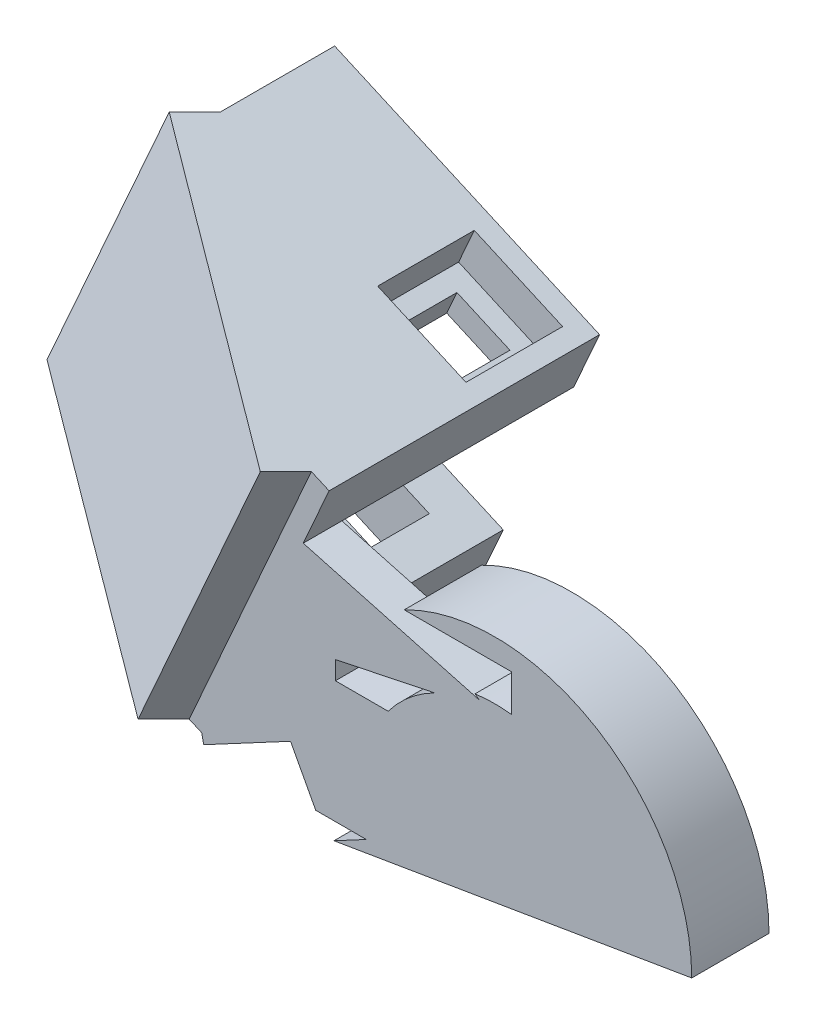
from build123d import *
from build123d.topology import SkipClean

# Parameters (mm, degrees)
BOSS_EXTRUDE1_DEPTH      = 5.08
CUT_EXTRUDE1_DEPTH       = 2.54
SKETCH3_W                = 9.11222741
SKETCH3_H                = 2.54
BOSS_EXTRUDE2_DEPTH      = 5.08
BOSS_EXTRUDE3_DEPTH      = 17.78
CUT_EXTRUDE2_DEPTH       = 15.24
CUT_EXTRUDE3_DEPTH       = 11.43
CHAMFER1_SIZE            = 10.265287786
CHAMFER1_SIZE_2          = 17.78
SKETCH7_W                = 3.81
SKETCH7_H                = 3.81
CUT_EXTRUDE4_DEPTH       = 25.4
SKETCH8_W                = 6.35
SKETCH8_H                = 6.35
CUT_EXTRUDE5_DEPTH       = 2.54
BOSS_EXTRUDE4_DEPTH      = 2.54
BOSS_EXTRUDE4_DEPTH_BACK = 2.54
BOSS_EXTRUDE5_START      = -5.08
BOSS_EXTRUDE5_DEPTH      = 5.08
BOSS_EXTRUDE6_START      = -2.54
BOSS_EXTRUDE6_DEPTH      = 2.54
CUT_EXTRUDE6_DEPTH       = 55.88
CUT_EXTRUDE7_START       = -5.08
CUT_EXTRUDE7_DEPTH       = 5.08
BOSS_EXTRUDE7_DEPTH      = 2.54


# Read off the part's stored shape, not the designer's step: Boss-Extrude5, Cut-Extrude7
with BuildPart() as part:
    # Sketch1 → Boss-Extrude1 (new body)
    with BuildSketch(Plane.XY):
        with BuildLine():
            Line((8.309836615, 7.848026213), (-11.143288506, -2.544016758))
            ThreePointArc((-11.143288506, -2.544016758), (-5.385698811, 10.08162429), (8.309836615, 7.848026213))
        make_face()
    extrude(amount=BOSS_EXTRUDE1_DEPTH)

    # Sketch2 → Cut-Extrude1 (cut)
    with SkipClean():  # the faces are left unmerged after this step: merging them gives an invalid solid
        with BuildSketch(Plane(origin=(0, 0, 0), x_dir=(-1, 0, 0), z_dir=(0, 0, -1))):
            with BuildLine():
                ThreePointArc((-3.514271346, 8.165904537), (4.188876853, 7.841263336), (8.741367154, 1.618826824))
                Line((8.741367154, 1.618826824), (-3.514271346, 8.165904537))
            make_face()
            with BuildLine():
                Line((8.741367154, 1.618826824), (-3.514271346, 8.165904537))
                ThreePointArc((-3.514271346, 8.165904537), (-4.803100251, 7.480797282), (-5.962452981, 6.594031729))
                Line((-5.962452981, 6.594031729), (8.795904873, -1.290022275))
                ThreePointArc((8.795904873, -1.290022275), (8.8884379, 0.166648428), (8.741367154, 1.618826824))
            make_face()
        extrude(amount=-CUT_EXTRUDE1_DEPTH, mode=Mode.SUBTRACT)

    # Sketch3 → Boss-Extrude2 (add)
    with SkipClean():  # the faces are left unmerged after this step: merging them gives an invalid solid
        with BuildSketch(Plane(origin=(-1.416725946, 2.652004727, 0), x_dir=(0.8820318713627303, 0.4711897472360366, 0), z_dir=(0.47118974723603657, -0.8820318713627302, 0))):
            with Locations((0, 3.81)):
                Rectangle(SKETCH3_W, SKETCH3_H)
        extrude(amount=BOSS_EXTRUDE2_DEPTH)

    # Sketch4 → Boss-Extrude3 (add)
    with SkipClean():  # the faces are left unmerged after this step: merging them gives an invalid solid
        with BuildSketch(Plane.XY.offset(5.08)):
            Polygon((-2.901644401, 16.029554576), (-20.315117145, 23.754414899), (-28.34897188, 5.644403245), (-10.935499136, -2.080457077), align=None)
        extrude(amount=-BOSS_EXTRUDE3_DEPTH)

    # Sketch5 → Cut-Extrude2 (cut)
    with BuildSketch(Plane(origin=(0, 0, -12.7), x_dir=(-1, 0, 0), z_dir=(0, 0, -1))):
        Polygon((8.432077676, 13.898059844), (0.608597096, 10.427454319), (5.243513289, -0.020629328), (13.066993869, 3.449976197), (22.818538605, 7.775897978), (18.183622412, 18.223981624), align=None)
    extrude(amount=-CUT_EXTRUDE2_DEPTH, mode=Mode.SUBTRACT)

    # Sketch6 → Cut-Extrude3 (cut)
    with BuildSketch(Plane(origin=(-0.869857896, -1.960844097, 0), x_dir=(0.914093057420647, -0.4055044788598195, 0), z_dir=(0.4055044788598195, 0.914093057420647, 0))):
        Polygon((-24.011429177, -2.54), (-38.355843434, 12.7), (-24.011429177, 12.7), align=None)
    extrude(amount=CUT_EXTRUDE3_DEPTH, mode=Mode.SUBTRACT)

    # Chamfer1
    # the kernel refuses this chamfer: 17.78, 10.265287786 mm, written as the material it takes off along each edge
    with BuildSketch(Plane(origin=(-1.662566122, 65.801219022, 5.08), x_dir=(-0.052920377689547264, 0.02347622050277695, -0.9983227437537927), z_dir=(-0.40550447885981916, -0.9140930574206472, 0))) as chamfer1_piece_1:
        Polygon((CHAMFER1_SIZE * 0.998322743772, CHAMFER1_SIZE * 0.0578938624038), (-CHAMFER1_SIZE_2 * 0.0578938624027, CHAMFER1_SIZE_2 * 0.998322743754), (0, 0), align=None)
    extrude(amount=111.808769435, mode=Mode.SUBTRACT)

    # Sketch7 → Cut-Extrude4 (cut)
    with BuildSketch(Plane(origin=(5.464527568, 12.318203553, 0), x_dir=(0.9140930574206471, -0.40550447885981944, 0), z_dir=(0.4055044788598195, 0.9140930574206472, 0))):
        with Locations((-13.597429177, 8.255)):
            Rectangle(SKETCH7_W, SKETCH7_H)
    extrude(amount=-CUT_EXTRUDE4_DEPTH, mode=Mode.SUBTRACT)

    # Sketch8 → Cut-Extrude5 (cut)
    with BuildSketch(Plane(origin=(5.464527568, 12.318203553, 0), x_dir=(0.9140930574206471, -0.40550447885981944, 0), z_dir=(0.4055044788598195, 0.9140930574206472, 0))):
        with Locations((-13.597429177, 8.255)):
            Rectangle(SKETCH8_W, SKETCH8_H)
    extrude(amount=-CUT_EXTRUDE5_DEPTH, mode=Mode.SUBTRACT)

    # Sketch10 → Boss-Extrude4 (add, two sides: drawn at the far end of the back side and taken through both)
    with BuildSketch(Plane(origin=(-4.392502173, 1.948575465, 8.323044218), x_dir=(0.8894427865769886, 0.10418568638497319, 0.4450133393041759), z_dir=(-0.457046528710329, 0.20275223942991202, 0.8660254037844353)).offset(-BOSS_EXTRUDE4_DEPTH_BACK)):
        Polygon((-26.934244752, 6.677804801), (-17.901786615, 24.311013357), (0.370973372, 14.950950547), (-8.661484766, -2.682258009), align=None)
    extrude(amount=BOSS_EXTRUDE4_DEPTH + BOSS_EXTRUDE4_DEPTH_BACK)

    # Boss-Extrude5 outline → Boss-Extrude5 (add)
    with BuildSketch(Plane.XY.offset(5.08).offset(BOSS_EXTRUDE5_START)):
        with BuildLine():
            Line((2.601911551, 4.798798792), (5.962452981, 6.594031729))
            ThreePointArc((5.962452981, 6.594031729), (2.56067771, 8.513226748), (-1.33537929, 8.789133186))
            Line((-1.33537929, 8.789133186), (-0.995970787, 9.554231902))
            ThreePointArc((-0.995970787, 9.554231902), (-3.936753752, 5.290676536), (-4.972191023, 0.215838758))
            Line((-4.972191023, 0.215838758), (4.804173359, 0.215838758))
            Line((4.804173359, 0.215838758), (4.995555467, 0.318076886))
            Line((4.995555467, 0.318076886), (2.601911551, 4.798798792))
        make_face()
        with BuildLine():
            ThreePointArc((1.359063718, 11.348913861), (4.156560335, 10.647436602), (6.689412036, 9.268045458))
            ThreePointArc((6.689412036, 9.268045458), (13.973263657, 7.123458233), (17.125808977, 0.215838758))
            Line((17.125808977, 0.215838758), (20.935808977, 0.215838758))
            ThreePointArc((20.935808977, 0.215838758), (14.385521725, 11.476326272), (1.359063718, 11.348913861))
        make_face()
    extrude(amount=BOSS_EXTRUDE5_DEPTH)

    # Sketch12 → Boss-Extrude6 (add)
    with BuildSketch(Plane.XY.offset(5.08).offset(BOSS_EXTRUDE6_START)):
        with BuildLine():
            ThreePointArc((17.125808977, 0.215838758), (13.973263657, 7.123458233), (6.689412036, 9.268045458))
            ThreePointArc((6.689412036, 9.268045458), (7.533158613, 8.59630277), (8.309836615, 7.848026213))
            Line((8.309836615, 7.848026213), (2.601911551, 4.798798792))
            Line((2.601911551, 4.798798792), (4.995555467, 0.318076886))
            Line((4.995555467, 0.318076886), (-2.581764519, -3.72979894))
            Line((-2.581764519, -3.72979894), (20.935808977, 0.215838758))
            Line((20.935808977, 0.215838758), (17.125808977, 0.215838758))
        make_face()
    extrude(amount=BOSS_EXTRUDE6_DEPTH)

    # Sketch13 → Cut-Extrude6 (cut)
    with BuildSketch(Plane.XY.offset(5.08)):
        Polygon((-0.455894293, -2.594139008), (-3.041719527, -3.975511244), (-3.779661608, -2.594139008), align=None)
    extrude(amount=-CUT_EXTRUDE6_DEPTH, mode=Mode.SUBTRACT)

    # Cut-Extrude7 outline → Cut-Extrude7 (cut)
    with BuildSketch(Plane(origin=(0, 0, 0), x_dir=(-1, 0, 0), z_dir=(0, 0, -1)).offset(CUT_EXTRUDE7_START)):
        with BuildLine():
            ThreePointArc((-7.17051589, 8.901044988), (-7.026535215, 8.886389823), (-6.882817494, 8.869347956))
            Line((-6.882817494, 8.869347956), (-5.6435439, 8.869347956))
            Line((-5.6435439, 8.869347956), (-5.6435439, 8.619618869))
            ThreePointArc((-5.6435439, 8.619618869), (-3.048054454, 7.409521405), (-0.984312942, 5.424106508))
            Line((-0.984312942, 5.424106508), (2.486117219, 5.424106508))
            Line((2.486117219, 5.424106508), (2.486117219, 8.869347956))
            Line((2.486117219, 8.869347956), (1.657843224, 8.869347956))
            ThreePointArc((1.657843224, 8.869347956), (1.333203623, 9.217874986), (0.995970787, 9.554231902))
            Line((0.995970787, 9.554231902), (0.608597096, 10.427454319))
            Line((0.608597096, 10.427454319), (2.328316525, 11.190345935))
            ThreePointArc((2.328316525, 11.190345935), (0.491068934, 11.41944619), (-1.359063718, 11.34891386))
            ThreePointArc((-1.359063718, 11.34891386), (-1.695483089, 11.542277864), (-2.037543, 11.725478978))
            Line((-2.037543, 11.725478978), (-9.08080046, 11.725478978))
            Line((-9.08080046, 11.725478978), (-9.08080046, 9.293556187))
            ThreePointArc((-9.08080046, 9.293556187), (-7.884268641, 9.359318505), (-6.689412036, 9.268045458))
            ThreePointArc((-6.689412036, 9.268045458), (-6.932393011, 9.087729482), (-7.17051589, 8.901044988))
        make_face()
    extrude(amount=CUT_EXTRUDE7_DEPTH, mode=Mode.SUBTRACT)

    # Sketch15 → Boss-Extrude7 (add)
    with BuildSketch(Plane(origin=(0, 0, 2.54), x_dir=(-1, 0, 0), z_dir=(0, 0, -1))):
        Polygon((-7.906818903, 8.804382246), (4.601113672, 12.198590573), (6.567709174, 7.765467415), (3.37435699, 6.448302999), align=None)
    extrude(amount=-BOSS_EXTRUDE7_DEPTH)


solid = part.part
